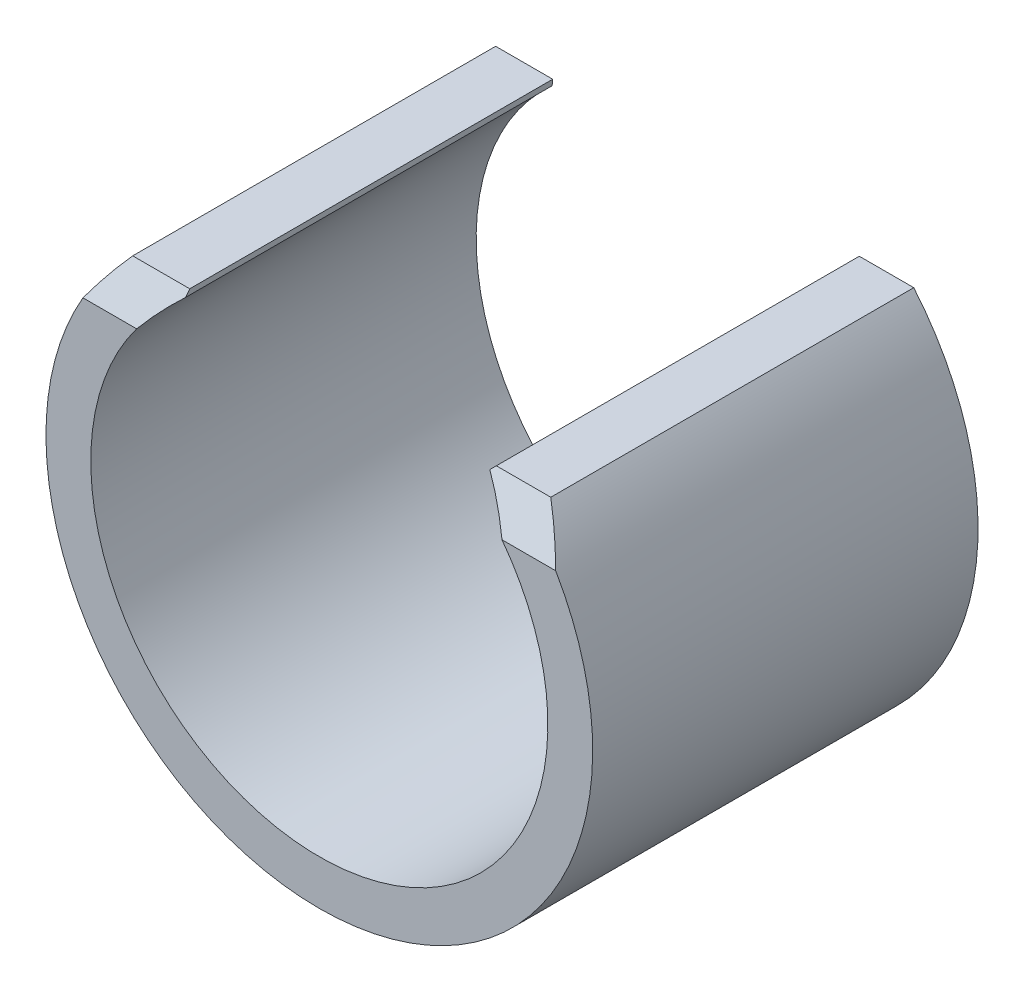
from build123d import *
from OCP.BRepFilletAPI import BRepFilletAPI_MakeChamfer

# Parameters (mm, degrees)
EXTRUDE_1_DEPTH  = 8.6
CHAMFER_1_SIZE   = 0.5
CHAMFER_1_SIZE2  = 0.866025404
CHAMFER_2_SIZE   = 0.142054737
CHAMFER_2_SIZE_2 = 0.2


with BuildPart() as part:
    # 草图1 → 凸台-拉伸1 (new body)
    with BuildSketch(Plane.XY):
        with BuildLine():
            Line((-128.840361964, -116.659683115), (-127.425332489, -116.659683115))
            ThreePointArc((-127.425332489, -116.659683115), (-132.090361964, -126.69001389), (-136.755391439, -116.659683115))
            Line((-136.755391439, -116.659683115), (-135.340361964, -116.659683115))
            ThreePointArc((-135.340361964, -116.659683115), (-132.090361964, -125.69001389), (-128.840361964, -116.659683115))
        make_face()
    extrude(amount=EXTRUDE_1_DEPTH)

    # 倒角1: one chamfer whose edges measure the first distance from different faces: ONE call of the kernel's chamfer builder (chamfer() names one face for all edges)
    chamfer_1_edges_1 = [part.edges().sort_by_distance(p)[0] for p in [
        (-136.047876701, -116.659683115, 8.6),
    ]]
    chamfer_1_side_1 = [part.faces().sort_by_distance(p)[0] for p in [
        (-136.047876701, -116.659683115, 4.3),
    ]]
    chamfer_1_edges_2 = [part.edges().sort_by_distance(p)[0] for p in [
        (-128.132847227, -116.659683115, 8.6),
    ]]
    chamfer_1_side_2 = [part.faces().sort_by_distance(p)[0] for p in [
        (-128.132847227, -116.659683115, 4.3),
    ]]
    chamfer_1 = BRepFilletAPI_MakeChamfer(part.part.solid().wrapped)
    for e in chamfer_1_edges_1:
        chamfer_1.Add(CHAMFER_1_SIZE, CHAMFER_1_SIZE2, e.wrapped, chamfer_1_side_1[0].wrapped)  # the first distance lies on this face
    for e in chamfer_1_edges_2:
        chamfer_1.Add(CHAMFER_1_SIZE, CHAMFER_1_SIZE2, e.wrapped, chamfer_1_side_2[0].wrapped)  # the first distance lies on this face
    add(Compound.cast(chamfer_1.Shape()), mode=Mode.REPLACE)

    # 倒角2
    # the kernel refuses this chamfer: 0.2, 0.142054737 mm, written as the material it takes off along each edge
    with BuildSketch(Plane(origin=(-135.340361964, -116.659683115, -0.524920029), x_dir=(-0.7577457918240572, -0.6525498563120925, 0), z_dir=(0, 0, 1))) as chamfer_2_piece_1:
        with BuildLine():
            Line((0.204125918, 0), (CHAMFER_2_SIZE * 0.757745791973, -CHAMFER_2_SIZE * 0.65254985644))
            Line((CHAMFER_2_SIZE * 0.757745791973, -CHAMFER_2_SIZE * 0.65254985644), (0, 0))
            ThreePointArc((0, 0), (0.104949569, -0.001020545), (0.204125918, 0))
        make_face()
    extrude(amount=9.149840059, mode=Mode.SUBTRACT)
    with BuildSketch(Plane(origin=(-128.840361964, -116.659683115, -0.514336598), x_dir=(1, 0, 0), z_dir=(0, 0, 1))) as chamfer_2_piece_2:
        with BuildLine():
            Line((CHAMFER_2_SIZE_2, 0), (0.108073152, -0.091926848))
            ThreePointArc((0.108073152, -0.091926848), (0.054110864, -0.045378858), (0, 0))
            Line((0, 0), (CHAMFER_2_SIZE_2, 0))
        make_face()
    extrude(amount=9.128673195, mode=Mode.SUBTRACT)


solid = part.part
